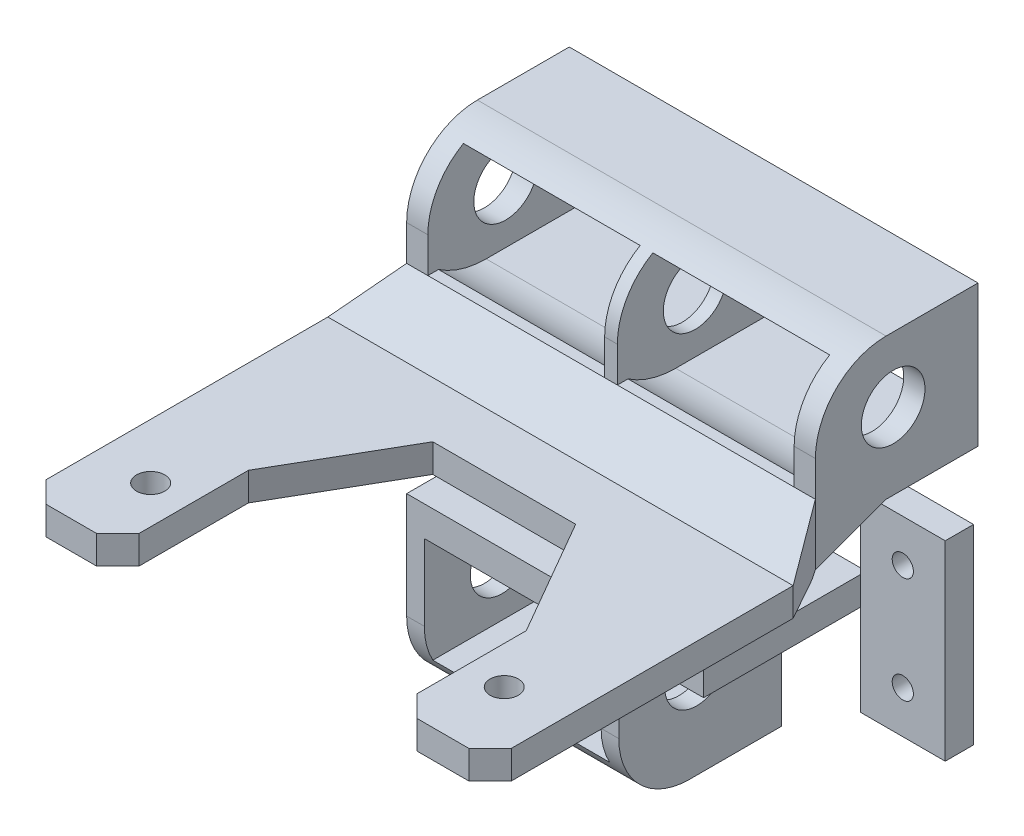
from build123d import *

# Parameters (mm, degrees)
SALIENTE_EXTRUIR3_DEPTH       = 3
CROQUIS6_W                    = 30
CROQUIS6_H                    = 20
CROQUIS6_W_2                  = 57.8
SALIENTE_EXTRUIR4_DEPTH       = 20
SALIENTE_EXTRUIR9_DEPTH       = 50
SALIENTE_EXTRUIR9_DEPTH_BACK  = 10
CROQUIS22_W                   = 65.8
CROQUIS22_H                   = 9
CROQUIS9_R                    = 4.5
CORTAR_EXTRUIR1_DEPTH         = 117.32145116
CROQUIS17_W                   = 25
CROQUIS17_H                   = 15.5
CORTAR_EXTRUIR6_DEPTH         = 23
CROQUIS18_W                   = 25
CROQUIS18_H                   = 15.75
CORTAR_EXTRUIR7_DEPTH         = 23
CROQUIS14_R                   = 2
CORTAR_EXTRUIR4_DEPTH         = 117.32145116
CROQUIS16_W                   = 3.75
CROQUIS16_H                   = 2
CORTAR_EXTRUIR5_DEPTH         = 105.247014346
SALIENTE_EXTRUIR10_DEPTH      = 51.8
CROQUIS24_W                   = 13.9
CROQUIS24_H                   = 5.2
CROQUIS24_W_2                 = 27.8
CORTAR_EXTRUIR9_DEPTH         = 115.462570301
REDONDEO1_R                   = 10
SALIENTE_EXTRUIR12_DEPTH      = 30
CROQUIS29_W                   = 30
CROQUIS29_H                   = 23
SALIENTE_EXTRUIR13_DEPTH      = 2
REDONDEO2_R                   = 10
CORTAR_EXTRUIR10_DEPTH        = 119.495063188
CHAFL_N1_SIZE                 = 3
CORTAR_EXTRUIR11_DEPTH        = 110.446242512
SALIENTE_EXTRUIR14_DEPTH      = 3
SALIENTE_EXTRUIR14_DEPTH_BACK = 1
CROQUIS12_R                   = 1.5
CROQUIS33_W                   = 12
CROQUIS33_H                   = 27
CROQUIS33_R                   = 1.5
SALIENTE_EXTRUIR15_DEPTH      = 4


with BuildPart() as part:
    # Croquis2 → Saliente-Extruir3 (new body)
    with BuildSketch(Plane.XY):
        Polygon((30, 41), (57.8, 41), (57.8, 66.2), (0, 66.2), (0, 0), (30, 0), align=None)
    extrude(amount=SALIENTE_EXTRUIR3_DEPTH)

    # Croquis6 → Saliente-Extruir4 (add)
    with BuildSketch(Plane.XY.offset(3)):
        with Locations((15, 10)):
            Rectangle(CROQUIS6_W, CROQUIS6_H)
        with Locations((28.9, 56.2)):
            Rectangle(CROQUIS6_W_2, CROQUIS6_H)
    extrude(amount=SALIENTE_EXTRUIR4_DEPTH)

    # Croquis22 → Saliente-Extruir9 (add, two sides: drawn at the far end of the back side and taken through both)
    with BuildSketch(Plane.XY.offset(23).offset(-SALIENTE_EXTRUIR9_DEPTH_BACK)):
        with Locations((28.9, 46.7)):
            Rectangle(CROQUIS22_W, CROQUIS22_H)
    extrude(amount=SALIENTE_EXTRUIR9_DEPTH + SALIENTE_EXTRUIR9_DEPTH_BACK)

    # Croquis9 → Cortar-Extruir1 (cut, through all)
    with BuildSketch(Plane(origin=(57.8, 0, 0), x_dir=(0, 0, -1), z_dir=(1, 0, 0))):
        with Locations((-12, 57)):
            Circle(CROQUIS9_R)
        with Locations((-12, 11)):
            Circle(CROQUIS9_R)
    extrude(amount=-CORTAR_EXTRUIR1_DEPTH, mode=Mode.SUBTRACT)

    # Croquis17 → Cortar-Extruir6 (cut)
    with BuildSketch(Plane.XY.offset(23)):
        with Locations((15, 11)):
            Rectangle(CROQUIS17_W, CROQUIS17_H)
    extrude(amount=-CORTAR_EXTRUIR6_DEPTH, mode=Mode.SUBTRACT)

    # Croquis18 → Cortar-Extruir7 (cut)
    with BuildSketch(Plane.XY.offset(23)):
        with Locations((15.5, 57)):
            Rectangle(CROQUIS18_W, CROQUIS18_H)
        with Locations((42.3, 57)):
            Rectangle(CROQUIS18_W, CROQUIS18_H)
    extrude(amount=-CORTAR_EXTRUIR7_DEPTH, mode=Mode.SUBTRACT)

    # Croquis14 → Cortar-Extruir4 (cut, through all)
    with BuildSketch(Plane(origin=(0, 66.2, 0), x_dir=(1, 0, 0), z_dir=(0, 1, 0))):
        with Locations(Location((3.8, -63, 0), (0, 0, 180))):
            Circle(CROQUIS14_R)
        with Locations(Location((53.8, -63, 0), (0, 0, 180))):
            Circle(CROQUIS14_R)
        Polygon((9.156552599, -54.525284491), (9.156552599, -73), (48.443447401, -73), (48.443447401, -54.525284491), (38.903629711, -38.001835556), (18.696370289, -38.001835556), align=None)
    extrude(amount=-CORTAR_EXTRUIR4_DEPTH, mode=Mode.SUBTRACT)

    # Croquis16 → Cortar-Extruir5 (cut, through all)
    with BuildSketch(Plane(origin=(30, 0, 0), x_dir=(0, 0, -1), z_dir=(1, 0, 0))):
        with Locations((-4.125, 35.087449781)):
            Rectangle(CROQUIS16_W, CROQUIS16_H)
        with Locations((-4.125, 39.087449781)):
            Rectangle(CROQUIS16_W, CROQUIS16_H)
        with Locations((-4.125, 31.087449781)):
            Rectangle(CROQUIS16_W, CROQUIS16_H)
        with Locations((-4.125, 27.087449781)):
            Rectangle(CROQUIS16_W, CROQUIS16_H)
    extrude(amount=-CORTAR_EXTRUIR5_DEPTH, mode=Mode.SUBTRACT)

    # Croquis23 → Saliente-Extruir10 (add)
    with BuildSketch(Plane(origin=(3, 0, 0), x_dir=(0, 0, -1), z_dir=(1, 0, 0))):
        with BuildLine():
            Line((-23, 49.125), (-14.755048184, 49.125))
            ThreePointArc((-14.755048184, 49.125), (-18.283503937, 49.655475162), (-21.5, 51.2))
            Line((-21.5, 51.2), (-23, 51.2))
            Line((-23, 51.2), (-23, 49.125))
        make_face()
    extrude(amount=SALIENTE_EXTRUIR10_DEPTH)

    # Croquis24 → Cortar-Extruir9 (cut, through all)
    with BuildSketch(Plane.XY.offset(3)):
        with Locations((-6.95, 43.6)):
            Rectangle(CROQUIS24_W, CROQUIS24_H)
        with Locations((43.9, 43.6)):
            Rectangle(CROQUIS24_W_2, CROQUIS24_H)
    extrude(amount=-CORTAR_EXTRUIR9_DEPTH, mode=Mode.SUBTRACT)

    # Redondeo1
    # the kernel refuses this fillet: 10 mm, written as the material it takes off along each edge
    with BuildSketch(Plane(origin=(-25, 66.2, 23), x_dir=(0, -1, 0), z_dir=(1, 0, 0))) as redondeo1_piece_1:
        with BuildLine():
            CenterArc((REDONDEO1_R, REDONDEO1_R), REDONDEO1_R, 180, 90)
            Line((0, REDONDEO1_R), (0, 0))
            Line((0, 0), (REDONDEO1_R, 0))
        make_face()
    extrude(amount=107.8, mode=Mode.SUBTRACT)

    # Croquis28 → Saliente-Extruir12 (add)
    with BuildSketch(Plane(origin=(30, 0, 0), x_dir=(0, 0, -1), z_dir=(1, 0, 0))):
        Polygon((-9, 46.2), (-3, 40.2), (-3, 46.2), align=None)
        Polygon((-3, 26), (-6, 23), (-3, 23), align=None)
    extrude(amount=-SALIENTE_EXTRUIR12_DEPTH)

    # Croquis29 → Saliente-Extruir13 (add)
    with BuildSketch(Plane.XZ):
        with Locations((15, 11.5)):
            Rectangle(CROQUIS29_W, CROQUIS29_H)
    extrude(amount=SALIENTE_EXTRUIR13_DEPTH)

    # Redondeo2
    # the kernel refuses this fillet: 10 mm, written as the material it takes off along each edge
    with BuildSketch(Plane(origin=(55, -2, 23), x_dir=(0, 0, -1), z_dir=(-1, 0, 0))) as redondeo2_piece_1:
        with BuildLine():
            CenterArc((REDONDEO2_R, -REDONDEO2_R), REDONDEO2_R, 90, 90)
            Line((0, -REDONDEO2_R), (0, 0))
            Line((0, 0), (REDONDEO2_R, 0))
        make_face()
    extrude(amount=80, mode=Mode.SUBTRACT)

    # Croquis31 → Cortar-Extruir10 (cut, through all)
    with BuildSketch(Plane(origin=(61.8, 0, 0), x_dir=(0, 0, -1), z_dir=(1, 0, 0))):
        Polygon((-73, 46.2), (-30.140740034, 46.2), (-23, 51.2), (-73, 51.2), align=None)
        Polygon((-13, 46.2), (-23.989909678, 42.2), (-13, 42.2), align=None)
    extrude(amount=-CORTAR_EXTRUIR10_DEPTH, mode=Mode.SUBTRACT)

    # Chaflán1
    chafl_n1_edges = [part.edges().sort_by_distance(p)[0] for p in [
        (48.443447401, 44.2, 73),
        (9.156552599, 44.2, 73),
        (-4, 44.2, 73),
        (61.8, 44.2, 73),
    ]]
    chamfer(chafl_n1_edges, length=CHAFL_N1_SIZE)

    # Croquis32 → Cortar-Extruir11 (cut, through all)
    with BuildSketch(Plane(origin=(0, 51.2, 0), x_dir=(1, 0, 0), z_dir=(0, 1, 0))):
        Polygon((0, -13), (-4, -13), (-4, -30.140740034), (0, -23), align=None)
        Polygon((57.8, -13), (61.8, -13), (61.8, -30.140740034), (57.8, -23), align=None)
    extrude(amount=-CORTAR_EXTRUIR11_DEPTH, mode=Mode.SUBTRACT)

    # Croquis12 → Saliente-Extruir14 (add, two sides: drawn at the far end of the back side and taken through both)
    with BuildSketch(Plane(origin=(0, 20, 0), x_dir=(1, 0, 0), z_dir=(0, 1, 0)).offset(-SALIENTE_EXTRUIR14_DEPTH_BACK)):
        Polygon((30, 0), (30, -3), (0, -3), (0, -23), (42, -23), (42, 0), align=None)
        with Locations(Location((36, -19, 0), (0, 0, 270))):
            Circle(CROQUIS12_R, mode=Mode.SUBTRACT)
        with Locations(Location((36, -4, 0), (0, 0, 270))):
            Circle(CROQUIS12_R, mode=Mode.SUBTRACT)
    extrude(amount=SALIENTE_EXTRUIR14_DEPTH + SALIENTE_EXTRUIR14_DEPTH_BACK)


with BuildPart() as body_2:
    # Croquis33 → Saliente-Extruir15 (new body)
    with BuildSketch(Plane.XY):
        with Locations((51.166419269, 22.8079829)):
            Rectangle(CROQUIS33_W, CROQUIS33_H)
        with Locations((51.166419269, 30.3079829)):
            Circle(CROQUIS33_R, mode=Mode.SUBTRACT)
        with Locations((51.166419269, 15.3079829)):
            Circle(CROQUIS33_R, mode=Mode.SUBTRACT)
    extrude(amount=SALIENTE_EXTRUIR15_DEPTH)


solid = Compound([part.part, body_2.part])
